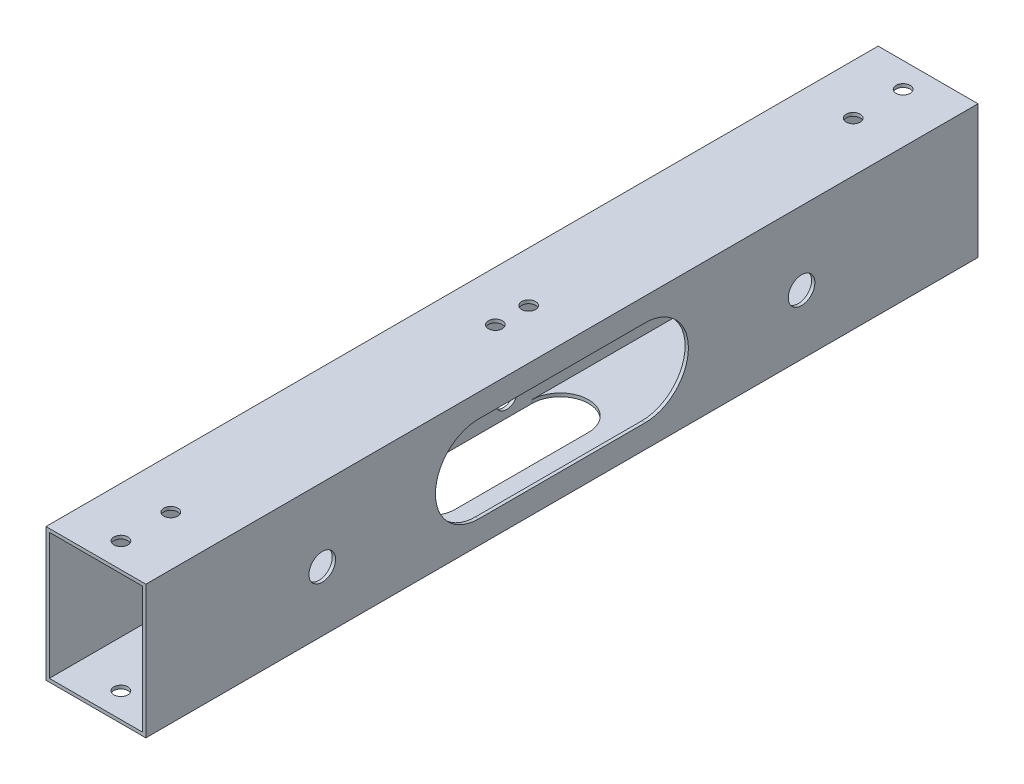
from build123d import *

# Parameters (mm, degrees)
SKETCH_1_W          = 30
SKETCH_1_H          = 40
SKETCH_1_W_2        = 28
SKETCH_1_H_2        = 38
EXTRUDE_1_DEPTH     = 250
SKETCH_3_R          = 2.1
CUT_EXTRUDE_1_DEPTH = 250
SKETCH_4_R          = 4
CUT_EXTRUDE_2_DEPTH = 250
SKETCH_5_R          = 7
CUT_EXTRUDE_3_DEPTH = 250
CUT_EXTRUDE_4_DEPTH = 20
CUT_EXTRUDE_6_DEPTH = 22
SKETCH_8_R          = 3.25
CUT_EXTRUDE_7_DEPTH = 22


with BuildPart() as part:
    # 草图1 → 凸台-拉伸1 (new body)
    with BuildSketch(Plane.XY):
        Rectangle(SKETCH_1_W, SKETCH_1_H)
        Rectangle(SKETCH_1_W_2, SKETCH_1_H_2, mode=Mode.SUBTRACT)
    extrude(amount=EXTRUDE_1_DEPTH)

    # 草图3 → 切除-拉伸1 (cut)
    with BuildSketch(Plane(origin=(0, 20, 0), x_dir=(1, 0, 0), z_dir=(0, 1, 0))):
        with Locations((0, -7.5)):
            Circle(SKETCH_3_R)
        with Locations((0, -22.5)):
            Circle(SKETCH_3_R)
        with Locations((0, -227.5)):
            Circle(SKETCH_3_R)
        with Locations((0, -242.5)):
            Circle(SKETCH_3_R)
        with Locations((0, -120)):
            Circle(SKETCH_3_R)
        with Locations((0, -130)):
            Circle(SKETCH_3_R)
    extrude(amount=-CUT_EXTRUDE_1_DEPTH, mode=Mode.SUBTRACT)

    # 草图4 → 切除-拉伸2 (cut)
    with BuildSketch(Plane(origin=(15, 0, 0), x_dir=(0, 0, -1), z_dir=(1, 0, 0))):
        with Locations((-53, -2)):
            Circle(SKETCH_4_R)
        with Locations((-197, -2)):
            Circle(SKETCH_4_R)
    extrude(amount=-CUT_EXTRUDE_2_DEPTH, mode=Mode.SUBTRACT)

    # 草图5 → 切除-拉伸3 (cut)
    with BuildSketch(Plane.ZY.offset(15)):
        with Locations((125, -2)):
            Circle(SKETCH_5_R)
    extrude(amount=-CUT_EXTRUDE_3_DEPTH, mode=Mode.SUBTRACT)

    # 草图6 → 切除-拉伸4 (cut)
    with BuildSketch(Plane.XZ.offset(20)):
        with BuildLine():
            Line((-14, 145), (-14, 105))
            ThreePointArc((-14, 105), (-5.5, 96.5), (3, 105))
            Line((3, 105), (3, 145))
            ThreePointArc((3, 145), (-5.5, 153.5), (-14, 145))
        make_face()
    extrude(amount=-CUT_EXTRUDE_4_DEPTH, mode=Mode.SUBTRACT)

    # 草图7 → 切除-拉伸6 (cut)
    with BuildSketch(Plane(origin=(15, 0, 0), x_dir=(0, 0, -1), z_dir=(1, 0, 0))):
        with BuildLine():
            Line((-150, 13), (-100, 13))
            ThreePointArc((-100, 13), (-87, 0), (-100, -13))
            Line((-100, -13), (-150, -13))
            ThreePointArc((-150, -13), (-163, 0), (-150, 13))
        make_face()
    extrude(amount=-CUT_EXTRUDE_6_DEPTH, mode=Mode.SUBTRACT)

    # 草图8 → 切除-拉伸7 (cut)
    with BuildSketch(Plane.ZY.offset(15)):
        with Locations((112.625, -14.5)):
            Circle(SKETCH_8_R)
        with Locations((137.375, -14.5)):
            Circle(SKETCH_8_R)
        with Locations((112.625, 10.25)):
            Circle(SKETCH_8_R)
        with Locations((137.375, 10.25)):
            Circle(SKETCH_8_R)
    extrude(amount=-CUT_EXTRUDE_7_DEPTH, mode=Mode.SUBTRACT)


solid = part.part
